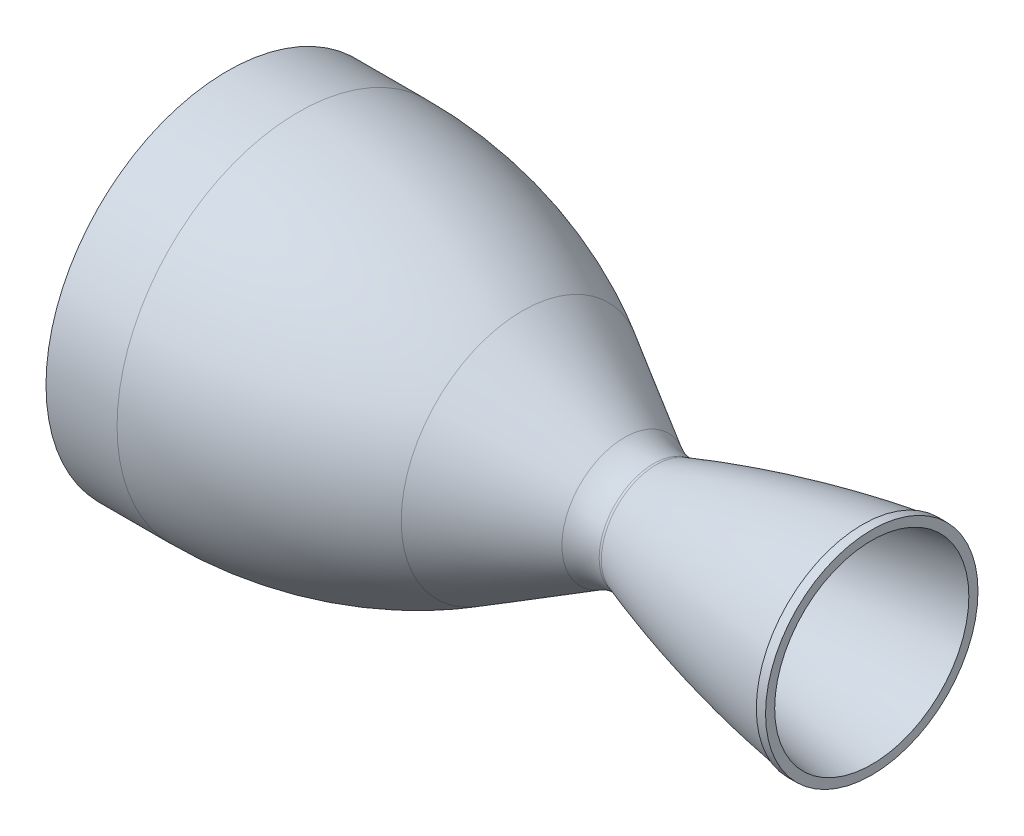
from build123d import *


with BuildPart() as part:
    # Model → Revolve1 (revolve)
    with BuildSketch(Plane.XY):
        with BuildLine():
            Line((0, 94.6787794), (39.110731504, 94.6787794))
            ThreePointArc((39.110731504, 94.6787794), (101.637396909, 86.446986704), (159.90297235, 62.312591822))
            Line((159.90297235, 62.312591822), (215.962822425, 29.946417451))
            ThreePointArc((215.962822425, 29.946417451), (224.983711605, 26.209840113), (234.664318334, 24.9353578))
            ThreePointArc((234.664318334, 24.9353578), (236.232163558, 25.0652745), (237.757240536, 25.451483257))
            add(Edge.make_bspline(
                [(237.757240536, 25.451483257), (294.7004774, 45.0004942), (354.679631, 53.4300176)],
                knots=[0, 0, 0, 1, 1, 1], degree=2))
            Line((354.679631, 53.4300176), (354.679631, 58.460579354))
            Line((354.679631, 58.460579354), (349.599631, 58.460579354))
            Line((349.599631, 58.460579354), (349.599631, 57.830742784))
            add(Edge.make_bspline(
                [(236.107739075, 30.256225178), (254.375979306, 36.527839646), (310.114236871, 51.937808841), (349.05350179, 57.750176471), (349.599631, 57.830742784)],
                knots=[0, 0, 0, 0.31824966, 0.954748981, 0.963799185, 0.963799185, 0.963799185], degree=2))
            ThreePointArc((236.107739075, 30.256225178), (235.396010426, 30.075987816), (234.664322529, 30.0153578))
            ThreePointArc((234.664322529, 30.0153578), (226.298514539, 31.116742725), (218.50282271, 34.345826338))
            Line((218.50282271, 34.345826338), (162.442972634, 66.712000709))
            ThreePointArc((162.442972634, 66.712000709), (102.952197817, 91.353889859), (39.110731504, 99.7587794))
            Line((39.110731504, 99.7587794), (0, 99.7587794))
            Line((0, 99.7587794), (0, 94.6787794))
        make_face()
    revolve(axis=Axis((0, 0, 0), (1, 0, 0)))


solid = part.part
